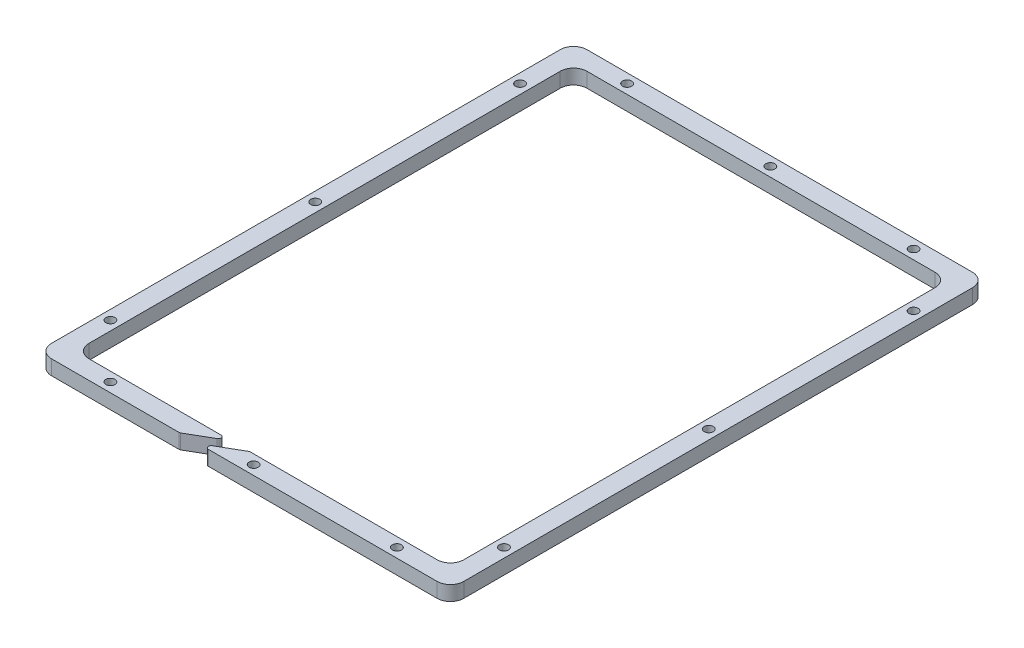
from build123d import *

# Parameters (mm, degrees)
SKETCH1_W           = 154
SKETCH1_H           = 200
SKETCH1_W_2         = 140
SKETCH1_H_2         = 186
BOSS_EXTRUDE1_DEPTH = 5.5
FILLET1_R           = 5
SKETCH3_R           = 1.7
CUT_EXTRUDE1_DEPTH  = 127.329925196
CUT_EXTRUDE2_DEPTH  = 127.329925196
FILLET2_R           = 1


with BuildPart() as part:
    # Sketch1 → Boss-Extrude1 (new body)
    with BuildSketch(Plane(origin=(0, 0, 0), x_dir=(1, 0, 0), z_dir=(0, 1, 0))):
        Rectangle(SKETCH1_W, SKETCH1_H)
        Rectangle(SKETCH1_W_2, SKETCH1_H_2, mode=Mode.SUBTRACT)
    extrude(amount=BOSS_EXTRUDE1_DEPTH)

    # Fillet1
    fillet1_edges = [part.edges().sort_by_distance(p)[0] for p in [
        (77, 2.75, -100),
        (77, 2.75, 100),
        (-77, 2.75, -100),
        (-77, 2.75, 100),
        (70, 2.75, -93),
        (70, 2.75, 93),
        (-70, 2.75, 93),
        (-70, 2.75, -93),
    ]]
    fillet(fillet1_edges, radius=FILLET1_R)

    # Sketch3 → Cut-Extrude1 (cut, through all)
    with BuildSketch(Plane.XZ):
        with Locations((73.5, -76.5)):
            Circle(SKETCH3_R)
        with Locations((53.5, -96.5)):
            Circle(SKETCH3_R)
        with Locations((-53.5, -96.5)):
            Circle(SKETCH3_R)
        with Locations((-73.5, -76.5)):
            Circle(SKETCH3_R)
        with Locations((-73.5, 0)):
            Circle(SKETCH3_R)
        with Locations((-73.5, 76.5)):
            Circle(SKETCH3_R)
        with Locations((-53.5, 96.5)):
            Circle(SKETCH3_R)
        with Locations((53.5, 96.5)):
            Circle(SKETCH3_R)
        with Locations((73.5, 76.5)):
            Circle(SKETCH3_R)
        with Locations((73.5, 0)):
            Circle(SKETCH3_R)
        with Locations((0, -96.5)):
            Circle(SKETCH3_R)
        with Locations((0, 96.5)):
            Circle(SKETCH3_R)
    extrude(amount=-CUT_EXTRUDE1_DEPTH, mode=Mode.SUBTRACT)

    # Sketch4 → Cut-Extrude2 (cut, through all)
    with BuildSketch(Plane(origin=(0, 5.5, 0), x_dir=(1, 0, 0), z_dir=(0, 1, 0))):
        Polygon((-17.124355653, -100), (-5, -93), (-12, -93), (-24.124355653, -100), align=None)
    extrude(amount=-CUT_EXTRUDE2_DEPTH, mode=Mode.SUBTRACT)

    # Fillet2
    fillet2_edges = [part.edges().sort_by_distance(p)[0] for p in [
        (-24.124355653, 2.75, 100),
        (-12, 2.75, 93),
        (-5, 2.75, 93),
        (-17.124355653, 2.75, 100),
    ]]
    fillet(fillet2_edges, radius=FILLET2_R)


solid = part.part
